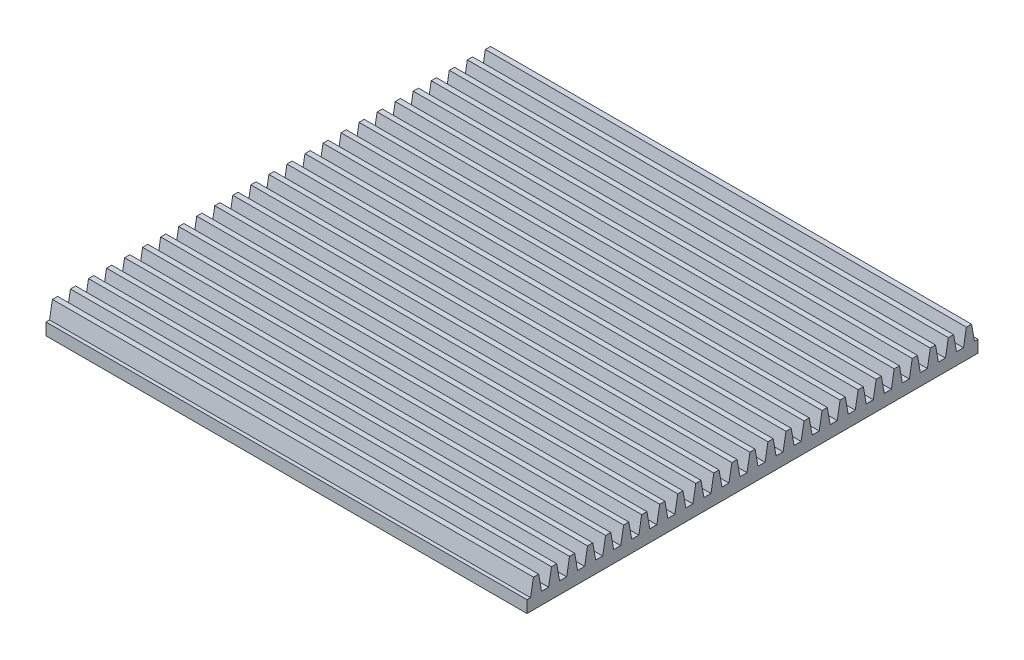
from build123d import *

# Parameters (mm, degrees)
BOSS_EXTRUDE1_DEPTH = 160
LPATTERN1_COUNT     = 25
LPATTERN1_PITCH     = 6


with BuildPart() as part:
    # Sketch1 → Boss-Extrude1 (new body)
    with BuildSketch(Plane(origin=(0, 0, 0), x_dir=(0, 0, -1), z_dir=(1, 0, 0))):
        Polygon((0, 0), (6, 0), (6, 4), (4.826453954, 4), (3.868289151, 9.434022626), (2.131710849, 9.434022626), (1.173546046, 4), (0, 4), align=None)
    boss_extrude1 = extrude(amount=BOSS_EXTRUDE1_DEPTH)

    # LPattern1: Boss-Extrude1 ×25
    with Locations(*[(0, 0, -i * LPATTERN1_PITCH) for i in range(1, LPATTERN1_COUNT)]):
        add(boss_extrude1)


solid = part.part
